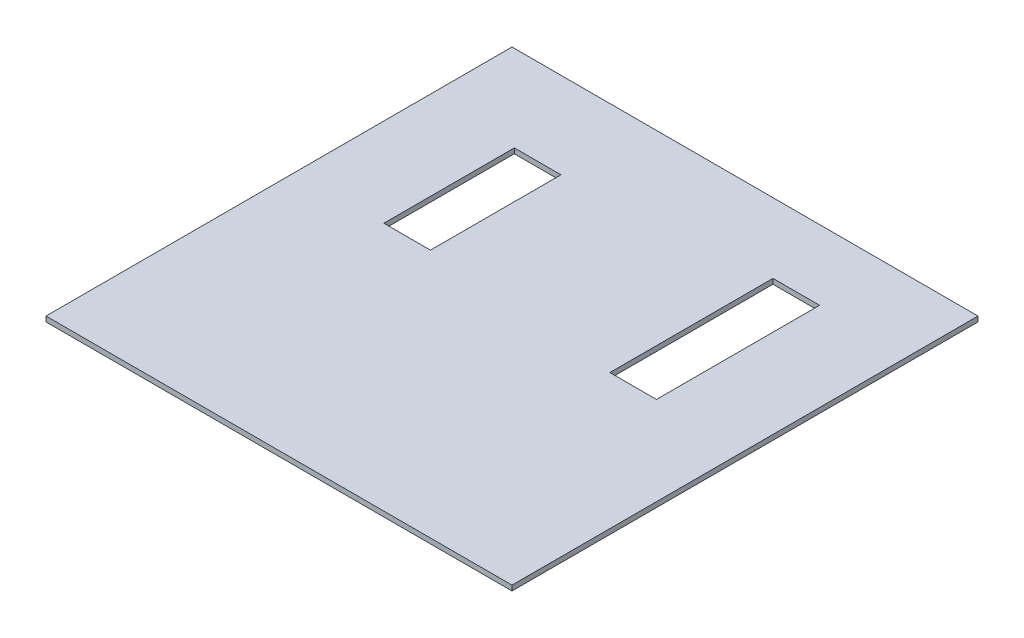
from build123d import *

# Parameters (mm, degrees)
SKETCH1_W           = 25.4
SKETCH1_H           = 25.4
BOSS_EXTRUDE1_DEPTH = 0.2794
SKETCH2_W           = 2.54
SKETCH2_H           = 7.112
SKETCH2_H_2         = 8.89
CUT_EXTRUDE1_DEPTH  = 36.922111079


with BuildPart() as part:
    # Sketch1 → Boss-Extrude1 (new body)
    with BuildSketch(Plane(origin=(0, 0, 0), x_dir=(1, 0, 0), z_dir=(0, 1, 0))):
        with Locations((12.7, 12.7)):
            Rectangle(SKETCH1_W, SKETCH1_H)
    extrude(amount=BOSS_EXTRUDE1_DEPTH)

    # Sketch2 → Cut-Extrude1 (cut, through all)
    with BuildSketch(Plane(origin=(0, 0.2794, 0), x_dir=(1, 0, 0), z_dir=(0, 1, 0))):
        with Locations((6.096, 17.145)):
            Rectangle(SKETCH2_W, SKETCH2_H)
        with Locations((19.304, 17.145)):
            Rectangle(SKETCH2_W, SKETCH2_H_2)
    extrude(amount=-CUT_EXTRUDE1_DEPTH, mode=Mode.SUBTRACT)


solid = part.part
